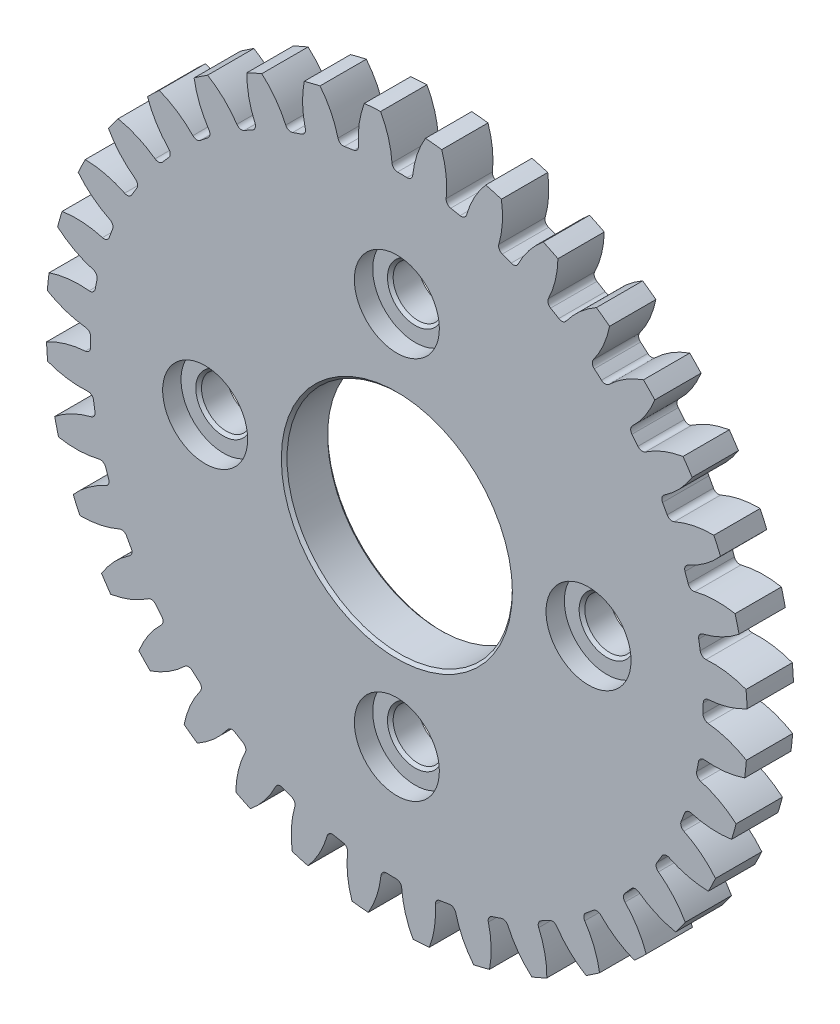
from build123d import *

# Parameters (mm, degrees)
SKETCH1_R                = 24.69999886
BOSS_EXTRUDE1_DEPTH      = 1.630374946
SKETCH8_R                = 7.9375
SKETCH8_R_2              = 1.7526
CUT_EXTRUDE1_DEPTH       = 36.082935699
CUT_EXTRUDE2_DEPTH       = 36.082935699
FILLET3_R                = 0.389999982
CIRPATTERN3_COUNT        = 36
FILLET3_OF_CIRPATTERN3_R = 0.389999982
SKETCH9_R                = 2.994
CUT_EXTRUDE3_DEPTH       = 1.292000064
CHAMFER1_SIZE            = 0.2


with BuildPart() as part:
    # Sketch1 → Boss-Extrude1 (new, symmetric)
    with BuildSketch(Plane.XY):
        Circle(SKETCH1_R)
    extrude(amount=BOSS_EXTRUDE1_DEPTH, both=True)

    # Sketch8 → Cut-Extrude1 (cut, through all)
    with BuildSketch(Plane.XY.offset(1.630374946)):
        Circle(SKETCH8_R)
        with Locations((0, 13.5)):
            Circle(SKETCH8_R_2)
        with Locations((13.5, 0)):
            Circle(SKETCH8_R_2)
        with Locations((0, -13.5)):
            Circle(SKETCH8_R_2)
        with Locations((-13.5, 0)):
            Circle(SKETCH8_R_2)
    extrude(amount=-CUT_EXTRUDE1_DEPTH, mode=Mode.SUBTRACT)

    # Sketch5 → Cut-Extrude2 (cut, through all)
    with BuildSketch(Plane(origin=(0, 0, 1.630374946), x_dir=(0.9998435808231984, -0.017686545356408814, 0), z_dir=(0, 0, 1))):
        with BuildLine():
            ThreePointArc((-2.239902489, 25.602202605), (-1.137864495, 23.712913221), (-0.70785597, 21.568386517))
            ThreePointArc((-0.70785597, 21.568386517), (0, 21.579999004), (0.70785597, 21.568386517))
            ThreePointArc((0.70785597, 21.568386517), (1.137864495, 23.712913221), (2.239902489, 25.602202605))
            ThreePointArc((2.239902489, 25.602202605), (0, 25.69999886), (-2.239902489, 25.602202605))
        make_face()
    cut_extrude2 = extrude(amount=-CUT_EXTRUDE2_DEPTH, mode=Mode.SUBTRACT)

    # Fillet3
    fillet3_edges = [part.edges().sort_by_distance(p)[0] for p in [
        (-0.326275001, 21.577532334, 0),
        (1.089215494, 21.552493281, 0),
    ]]
    fillet(fillet3_edges, radius=FILLET3_R)

    # CirPattern3: Cut-Extrude2 ×36 about axis
    cirpattern3_axis = Axis((0, 0, 1.630374946), (0, 0, -1))
    for i in range(1, CIRPATTERN3_COUNT):
        add(cut_extrude2.rotate(cirpattern3_axis, i * 360 / CIRPATTERN3_COUNT), mode=Mode.SUBTRACT)

    # Fillet3 of CirPattern3
    fillet3_of_cirpattern3_edges = [part.edges().sort_by_distance(p)[0] for p in [
        (3.425581018, 21.306378193, 0),
        (4.815219045, 21.035922194, 0),
        (7.073352491, 20.387840532, 0),
        (8.394914603, 19.880185256, 0),
        (10.506203728, 18.849828653, 0),
        (11.719534928, 18.120398949, 0),
        (13.619829281, 16.739074269, 0),
        (14.688063115, 15.81003349, 0),
        (16.319623213, 14.119711583, 0),
        (17.210301937, 13.019288162, 0),
        (18.523553652, 11.071328607, 0),
        (19.209614443, 9.832958353, 0),
        (20.164655287, 7.686548912, 0),
        (20.625252535, 6.347859079, 0),
        (21.193064074, 4.068217319, 0),
        (21.414202765, 2.669883319, 0),
        (21.577532334, 0.326275001, 0),
        (21.552493281, -1.089215494, 0),
        (21.306378193, -3.425581018, 0),
        (21.035922194, -4.815219045, 0),
        (20.387840532, -7.073352491, 0),
        (19.880185256, -8.394914603, 0),
        (18.849828653, -10.506203728, 0),
        (18.120398949, -11.719534928, 0),
        (16.739074269, -13.619829281, 0),
        (15.81003349, -14.688063115, 0),
        (14.119711583, -16.319623213, 0),
        (13.019288162, -17.210301937, 0),
        (11.071328607, -18.523553652, 0),
        (9.832958353, -19.209614443, 0),
        (7.686548912, -20.164655287, 0),
        (6.347859079, -20.625252535, 0),
        (4.068217319, -21.193064074, 0),
        (2.669883319, -21.414202765, 0),
        (0.326275001, -21.577532334, 0),
        (-1.089215494, -21.552493281, 0),
        (-3.425581018, -21.306378193, 0),
        (-4.815219045, -21.035922194, 0),
        (-7.073352491, -20.387840532, 0),
        (-8.394914603, -19.880185256, 0),
        (-10.506203728, -18.849828653, 0),
        (-11.719534928, -18.120398949, 0),
        (-13.619829281, -16.739074269, 0),
        (-14.688063115, -15.81003349, 0),
        (-16.319623213, -14.119711583, 0),
        (-17.210301937, -13.019288162, 0),
        (-18.523553652, -11.071328607, 0),
        (-19.209614443, -9.832958353, 0),
        (-20.164655287, -7.686548912, 0),
        (-20.625252535, -6.347859079, 0),
        (-21.193064074, -4.068217319, 0),
        (-21.414202765, -2.669883319, 0),
        (-21.577532334, -0.326275001, 0),
        (-21.552493281, 1.089215494, 0),
        (-21.306378193, 3.425581018, 0),
        (-21.035922194, 4.815219045, 0),
        (-20.387840532, 7.073352491, 0),
        (-19.880185256, 8.394914603, 0),
        (-18.849828653, 10.506203728, 0),
        (-18.120398949, 11.719534928, 0),
        (-16.739074269, 13.619829281, 0),
        (-15.81003349, 14.688063115, 0),
        (-14.119711583, 16.319623213, 0),
        (-13.019288162, 17.210301937, 0),
        (-11.071328607, 18.523553652, 0),
        (-9.832958353, 19.209614443, 0),
        (-7.686548912, 20.164655287, 0),
        (-6.347859079, 20.625252535, 0),
        (-4.068217319, 21.193064074, 0),
        (-2.669883319, 21.414202765, 0),
    ]]
    fillet(fillet3_of_cirpattern3_edges, radius=FILLET3_OF_CIRPATTERN3_R)

    # Sketch9 → Cut-Extrude3 (cut)
    with BuildSketch(Plane.XY.offset(1.630374946)):
        with Locations((0, 13.5)):
            Circle(SKETCH9_R)
        with Locations((13.5, 0)):
            Circle(SKETCH9_R)
        with Locations((0, -13.5)):
            Circle(SKETCH9_R)
        with Locations((-13.5, 0)):
            Circle(SKETCH9_R)
    extrude(amount=-CUT_EXTRUDE3_DEPTH, mode=Mode.SUBTRACT)

    # Chamfer1
    chamfer1_edges = [part.edges().sort_by_distance(p)[0] for p in [
        (-7.9375, 0, 1.630374946),
        (-7.9375, 0, -1.630374946),
        (-15.2526, 0, 0.338374882),
        (-1.7526, -13.5, 0.338374882),
        (11.7474, 0, 0.338374882),
        (-1.7526, 13.5, 0.338374882),
    ]]
    chamfer(chamfer1_edges, length=CHAMFER1_SIZE)


solid = part.part
